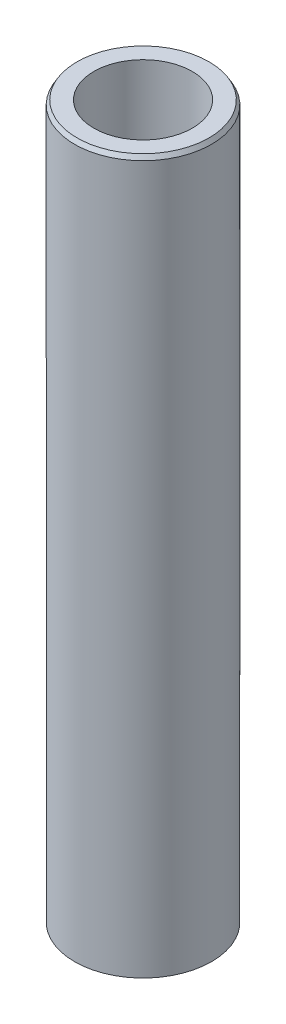
from build123d import *
from OCP.BRepFilletAPI import BRepFilletAPI_MakeChamfer

# Parameters (mm, degrees)
SKETCH1_R           = 57.5
BOSS_EXTRUDE1_DEPTH = 600
SKETCH2_R           = 41.314235897
CUT_EXTRUDE1_DEPTH  = 606.485342515
CHAMFER1_SIZE       = 3.624856572
CHAMFER1_SIZE2      = 2.092811918


with BuildPart() as part:
    # Sketch1 → Boss-Extrude1 (new body)
    with BuildSketch(Plane(origin=(0, 0, 0), x_dir=(1, 0, 0), z_dir=(0, 1, 0))):
        Circle(SKETCH1_R)
    extrude(amount=BOSS_EXTRUDE1_DEPTH)

    # Sketch2 → Cut-Extrude1 (cut, through all)
    with BuildSketch(Plane(origin=(0, 0, 0), x_dir=(1, 0, 0), z_dir=(0, 1, 0))):
        Circle(SKETCH2_R)
    extrude(amount=CUT_EXTRUDE1_DEPTH, mode=Mode.SUBTRACT)

    # Chamfer1: one chamfer whose edges measure the first distance from different faces: ONE call of the kernel's chamfer builder (chamfer() names one face for all edges)
    chamfer1_edges_1 = [part.edges().sort_by_distance(p)[0] for p in [
        (-57.5, 600, 0),
    ]]
    chamfer1_side_1 = [part.faces().sort_by_distance(p)[0] for p in [
        (-57.5, 300, 0),
    ]]
    chamfer1_edges_2 = [part.edges().sort_by_distance(p)[0] for p in [
        (-57.5, 0, 0),
    ]]
    chamfer1_side_2 = [part.faces().sort_by_distance(p)[0] for p in [
        (-55.873654403, 0, 0),
    ]]
    chamfer1 = BRepFilletAPI_MakeChamfer(part.part.solid().wrapped)
    for e in chamfer1_edges_1:
        chamfer1.Add(CHAMFER1_SIZE, CHAMFER1_SIZE2, e.wrapped, chamfer1_side_1[0].wrapped)  # the first distance lies on this face
    for e in chamfer1_edges_2:
        chamfer1.Add(CHAMFER1_SIZE, CHAMFER1_SIZE2, e.wrapped, chamfer1_side_2[0].wrapped)  # the first distance lies on this face
    add(Compound.cast(chamfer1.Shape()), mode=Mode.REPLACE)


solid = part.part
